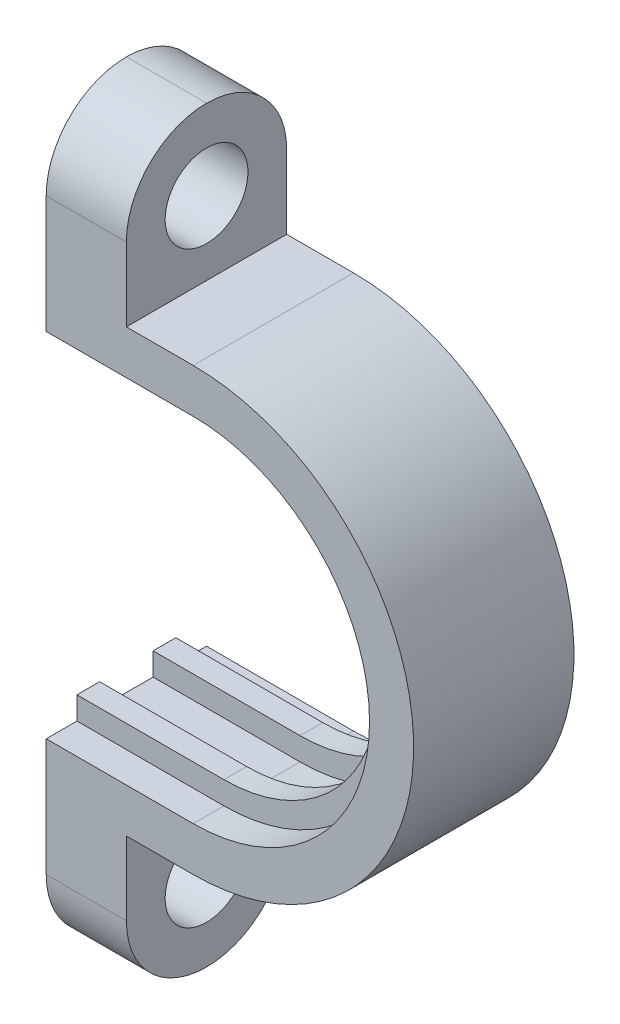
from build123d import *

# Parameters (mm, degrees)
EXTRUDE_1_DEPTH     = 6
SKETCH_2_R          = 1.55
CUT_EXTRUDE_1_DEPTH = 6
FILLET_2_R          = 3
SKETCH_3_W          = 2
SKETCH_3_H          = 0.85
CUT_EXTRUDE_2_DEPTH = 5.5
SKETCH_4_W          = 1.15
SKETCH_4_H          = 0.85
SKETCH_4_W_2        = 2


with BuildPart() as part:
    # 草图1 → 凸台-拉伸1 (new body)
    with BuildSketch(Plane.XY):
        with BuildLine():
            Line((-5.5, 14), (-5.5, 5.75))
            Line((-5.5, 5.75), (0, 5.75))
            ThreePointArc((0, 5.75), (5.75, 0), (0, -5.75))
            Line((0, -5.75), (-5.5, -5.75))
            Line((-5.5, -5.75), (-5.5, -14))
            Line((-5.5, -14), (-2.5, -14))
            Line((-2.5, -14), (-2.5, -8.25))
            Line((-2.5, -8.25), (0, -8.25))
            ThreePointArc((0, -8.25), (8.25, 0), (0, 8.25))
            Line((0, 8.25), (-2.5, 8.25))
            Line((-2.5, 8.25), (-2.5, 14))
            Line((-2.5, 14), (-5.5, 14))
        make_face()
    extrude(amount=EXTRUDE_1_DEPTH)

    # 草图2 → 切除-拉伸1 (cut)
    with BuildSketch(Plane(origin=(-2.5, 0, 0), x_dir=(0, 0, -1), z_dir=(1, 0, 0))):
        with Locations(Location((-3, -11, 0), (0, 0, 90))):
            Circle(SKETCH_2_R)
        with Locations(Location((-3, 11, 0), (0, 0, 90))):
            Circle(SKETCH_2_R)
    extrude(amount=-CUT_EXTRUDE_1_DEPTH, mode=Mode.SUBTRACT)

    # 圆角2
    fillet_2_edges = [part.edges().sort_by_distance(p)[0] for p in [
        (-4, -14, 0),
        (-4, -14, 6),
        (-4, 14, 0),
        (-4, 14, 6),
    ]]
    fillet(fillet_2_edges, radius=FILLET_2_R - 0.0001)  # a hair under: the kernel refuses the full size

    # 草图3 → 切除-拉伸2 (cut)
    with BuildSketch(Plane.ZY.offset(5.5)):
        with Locations((0.15, 6.175)):
            Rectangle(SKETCH_3_W, SKETCH_3_H)
        with Locations((3, 6.175)):
            Rectangle(SKETCH_3_W, SKETCH_3_H)
        with Locations((5.85, -6.175)):
            Rectangle(SKETCH_3_W, SKETCH_3_H)
        with Locations((5.85, 6.175)):
            Rectangle(SKETCH_3_W, SKETCH_3_H)
        with Locations((3, -6.175)):
            Rectangle(SKETCH_3_W, SKETCH_3_H)
        with Locations((0.15, -6.175)):
            Rectangle(SKETCH_3_W, SKETCH_3_H)
    extrude(amount=-CUT_EXTRUDE_2_DEPTH, mode=Mode.SUBTRACT)

    # 草图4 → 切除-旋转1 (revolve, cut)
    with BuildSketch(Plane.ZY):
        with Locations((5.425, 6.175)):
            Rectangle(SKETCH_4_W, SKETCH_4_H)
        with Locations((3, 6.175)):
            Rectangle(SKETCH_4_W_2, SKETCH_4_H)
        with Locations((0.575, 6.175)):
            Rectangle(SKETCH_4_W, SKETCH_4_H)
    revolve(axis=Axis((0, 0, 0), (0, 0, 1)), mode=Mode.SUBTRACT)


solid = part.part
